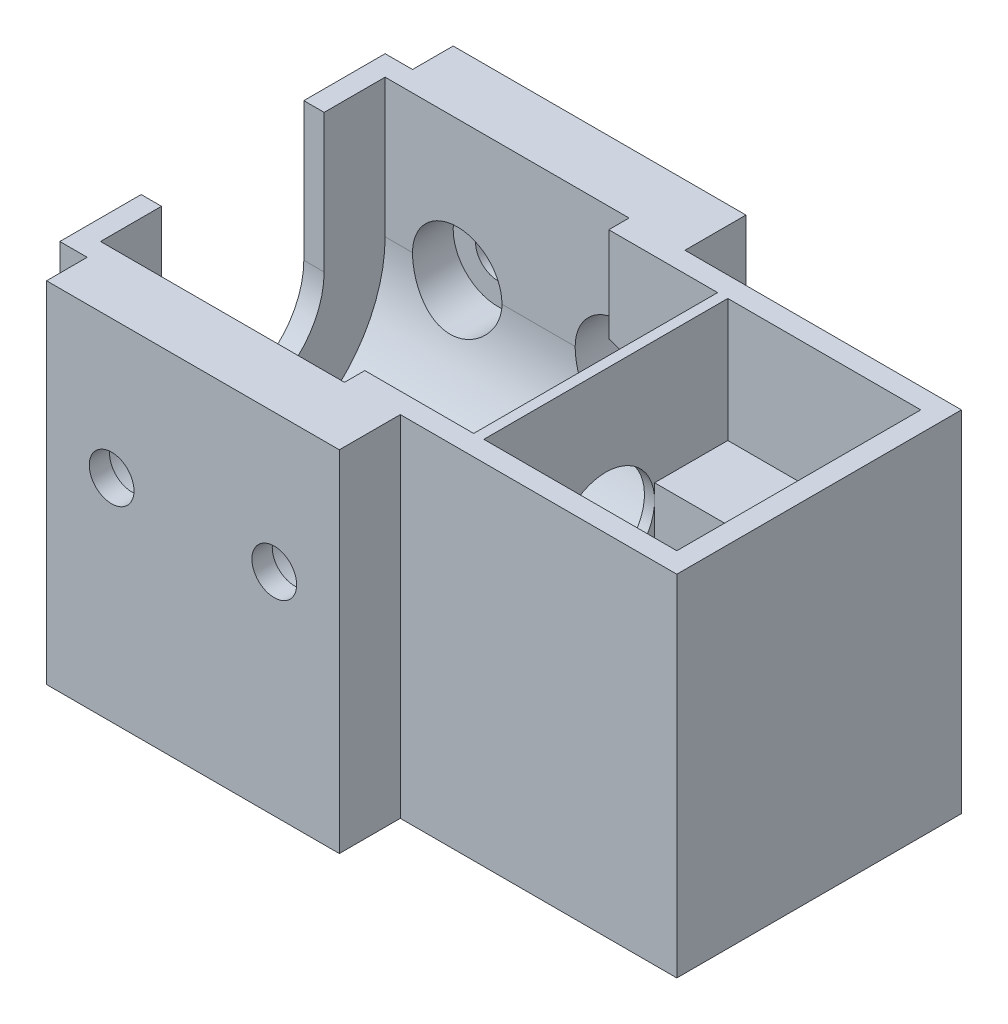
from build123d import *
from build123d.topology import SkipClean

# Parameters (mm, degrees)
SKETCH1_W                       = 116.84
SKETCH1_H                       = 50.8
BOSS_EXTRUDE1_DEPTH             = 31.75
SKETCH38_W                      = 20
SKETCH38_H                      = 20
CUT_EXTRUDE33_DEPTH             = 33.3134
SKETCH37_W                      = 63.5
SKETCH37_H                      = 25.4
CUT_EXTRUDE32_DEPTH             = 132.302277589
BOSS_EXTRUDE5_DEPTH             = 25.4
BOSS_EXTRUDE6_REACH             = 98.929
SKETCH40_W                      = 16.9009
SKETCH40_H                      = 20
SKETCH41_R                      = 3.113413941
CUT_EXTRUDE34_DEPTH             = 97.928543268
CUT_EXTRUDE35_DEPTH             = 97.928543399
CUT_EXTRUDE35_DEPTH_BACK        = 97.928543399
SKETCH42_R                      = 3.4925
SKETCH43_R                      = 6.985
CUT_EXTRUDE36_DEPTH             = 28.575
CUT_EXTRUDE37_START             = 28.575
SKETCH43_2_R                    = 6.985
CUT_EXTRUDE37_DEPTH             = 28.575
SKETCH44_W                      = 15.9125
SKETCH44_H                      = 38.1
CUT_EXTRUDE38_DEPTH             = 35.4
CUT_EXTRUDE39_REACH             = 98.929
SKETCH45_W                      = 14.2259
SKETCH45_H                      = 15.4
CUT_EXTRUDE39_DIRECTION_2_REACH = 98.929
SKETCH46_W                      = 43.18
SKETCH46_H                      = 9.525
SKETCH46_W_2                    = 27.94
SKETCH46_H_2                    = 6.35
CUT_EXTRUDE40_DEPTH             = 97.928543399
SKETCH49_W                      = 23.6641
SKETCH49_H                      = 50.8
CUT_EXTRUDE42_DEPTH             = 97.928543399
SKETCH50_W                      = 0.254
SKETCH50_H                      = 1.524
CUT_EXTRUDE43_DEPTH             = 2.54
SKETCH52_R                      = 0.3175
CUT_EXTRUDE45_DEPTH             = 0.0508
SKETCH53_R                      = 2
CUT_EXTRUDE46_DEPTH             = 0.0254
BOSS_EXTRUDE7_DEPTH             = 2.54
SKETCH55_W                      = 15.9125
SKETCH55_H                      = 9.05
BOSS_EXTRUDE8_DEPTH             = 17.46
BOSS_EXTRUDE9_REACH             = 81.679
BOSS_EXTRUDE9_DIRECTION_2_REACH = 81.679
CUT_EXTRUDE47_DEPTH             = 7.62
SKETCH58_R                      = 3.113413941
BOSS_EXTRUDE10_DEPTH            = 7.62
SKETCH59_W                      = 0.5
SKETCH59_H                      = 20
CUT_EXTRUDE48_DEPTH             = 7.62
CUT_EXTRUDE44_DEPTH             = 0.635
SKETCH60_W                      = 121.35651469
SKETCH60_H                      = 81.059088534
CUT_EXTRUDE49_DEPTH             = 10.16
SKETCH61_R                      = 8.976217823
SKETCH61_R_2                    = 7.62
BOSS_EXTRUDE11_DEPTH            = 1.5875
BOSS_EXTRUDE12_REACH            = 80.084
SKETCH62_W                      = 1.5875
SKETCH62_H                      = 15.24
SKETCH64_W                      = 30.1384
SKETCH64_H                      = 38.1
BOSS_EXTRUDE14_DEPTH            = 6.35
BOSS_EXTRUDE16_REACH            = 91.468
SKETCH65_W                      = 2.38
SKETCH65_H                      = 9.84
SKETCH66_W                      = 0.5
SKETCH66_H                      = 20
CUT_EXTRUDE50_DEPTH             = 20


with BuildPart() as part:
    # Sketch1 → Boss-Extrude1 (new, symmetric)
    with BuildSketch(Plane.XY):
        with Locations((-17.78, -25.4)):
            Rectangle(SKETCH1_W, SKETCH1_H)
    extrude(amount=BOSS_EXTRUDE1_DEPTH, both=True)

    # Sketch2 → Cut-Revolve1 (revolve, cut)
    with BuildSketch(Plane.XY, mode=Mode.PRIVATE) as cut_revolve1_sk:
        Polygon((-49.3609, -3.175), (-49.3609, -12.7), (-220.202391615, -12.7), (-220.202391615, -25.4), (-157.809194346, -25.4), (-128.417210056, -25.4), (6.8382, -25.4), (40.64, -25.4), (40.64, -17.78), (23.7391, -17.78), (5.7391, -17.78), (5.7391, -6.35), (-11.2609, -6.35), (-11.2609, -3.175), align=None)
    revolve(cut_revolve1_sk.sketch.rotate(Axis((-152.482877195, -25.4, 0), (1, 0, 0)), 180), axis=Axis((-152.482877195, -25.4, 0), (1, 0, 0)), mode=Mode.SUBTRACT)

    # Sketch38 → Cut-Extrude33 (cut)
    with BuildSketch(Plane(origin=(40.64, 0, 0), x_dir=(0, 0, -1), z_dir=(1, 0, 0))):
        with Locations((0, -25.4)):
            Rectangle(SKETCH38_W, SKETCH38_H)
    extrude(amount=-CUT_EXTRUDE33_DEPTH, mode=Mode.SUBTRACT)

    # Sketch37 → Cut-Extrude32 (cut, through all)
    with BuildSketch(Plane(origin=(40.64, 0, 0), x_dir=(0, 0, -1), z_dir=(1, 0, 0))):
        with Locations((0, -12.7)):
            Rectangle(SKETCH37_W, SKETCH37_H)
    extrude(amount=-CUT_EXTRUDE32_DEPTH, mode=Mode.SUBTRACT)

    # Sketch39 → Boss-Extrude5 (add)
    with BuildSketch(Plane(origin=(0, -25.4, 0), x_dir=(1, 0, 0), z_dir=(0, 1, 0))):
        Polygon((5.7391, 19.05), (5.7391, 7.62), (7.3266, 7.62), (7.3266, 10), (40.64, 10), (40.64, 31.75), (-76.2, 31.75), (-76.2, 12.7), (-49.3609, 12.7), (-49.3609, 22.225), (-11.2609, 22.225), (-11.2609, 19.05), align=None)
        Polygon((40.64, -10), (7.3266, -10), (7.3266, -7.62), (5.7391, -7.62), (5.7391, -19.05), (-11.2609, -19.05), (-11.2609, -22.225), (-49.3609, -22.225), (-49.3609, -12.7), (-76.2, -12.7), (-76.2, -31.75), (40.64, -31.75), align=None)
    extrude(amount=BOSS_EXTRUDE5_DEPTH)

    # Sketch40 → Boss-Extrude6 (add, up to next)
    with BuildSketch(Plane(origin=(0, 0, 0), x_dir=(1, 0, 0), z_dir=(0, 1, 0)), mode=Mode.PRIVATE) as boss_extrude6_sk1:
        with Locations((32.18955, 0)):
            Rectangle(SKETCH40_W, SKETCH40_H)
    boss_extrude6_tool1 = extrude(boss_extrude6_sk1.sketch, amount=-BOSS_EXTRUDE6_REACH, mode=Mode.PRIVATE) - part.part
    add(boss_extrude6_tool1.solids().sort_by_distance((32.18955, 0, 0))[0])

    # Sketch41 → Cut-Extrude34 (cut, through all)
    with BuildSketch(Plane(origin=(0, 0, 0), x_dir=(1, 0, 0), z_dir=(0, 1, 0))):
        with Locations(Location((-57.15, 0, 0), (0, 0, 270))):
            Circle(SKETCH41_R)
        with Locations(Location((-31.75, 0, 0), (0, 0, 270))):
            Circle(SKETCH41_R)
        with Locations(Location((-6.35, 0, 0), (0, 0, 270))):
            Circle(SKETCH41_R)
    extrude(amount=-CUT_EXTRUDE34_DEPTH, mode=Mode.SUBTRACT)

    # Sketch42 → Cut-Extrude35 (cut, two sides: drawn at the far end of the back side and taken through both)
    with BuildSketch(Plane.XY.offset(-CUT_EXTRUDE35_DEPTH_BACK)):
        with Locations((-38.1, -25.4)):
            Circle(SKETCH42_R)
        with Locations((-12.7, -25.4)):
            Circle(SKETCH42_R)
    extrude(amount=CUT_EXTRUDE35_DEPTH + CUT_EXTRUDE35_DEPTH_BACK, mode=Mode.SUBTRACT)

    # Sketch43 → Cut-Extrude36 (cut)
    with BuildSketch(Plane.XY):
        with Locations(Location((-38.1, -25.4, 0), (0, 0, 180))):
            Circle(SKETCH43_R)
        with Locations(Location((-12.7, -25.4, 0), (0, 0, 180))):
            Circle(SKETCH43_R)
    extrude(amount=-CUT_EXTRUDE36_DEPTH, mode=Mode.SUBTRACT)

    # Sketch43<2> → Cut-Extrude37 (cut)
    with BuildSketch(Plane.XY.offset(CUT_EXTRUDE37_START)):
        with Locations(Location((-38.1, -25.4, 0), (0, 0, 180))):
            Circle(SKETCH43_2_R)
        with Locations(Location((-12.7, -25.4, 0), (0, 0, 180))):
            Circle(SKETCH43_2_R)
    extrude(amount=-CUT_EXTRUDE37_DEPTH, mode=Mode.SUBTRACT)

    # Sketch44 → Cut-Extrude38 (cut)
    with BuildSketch(Plane(origin=(0, 0, 0), x_dir=(1, 0, 0), z_dir=(0, 1, 0))):
        with Locations((15.28285, 0)):
            Rectangle(SKETCH44_W, SKETCH44_H)
    extrude(amount=-CUT_EXTRUDE38_DEPTH, mode=Mode.SUBTRACT)

    # Cut-Extrude39: up to this face of the body (flat: up to its plane)
    cut_extrude39_end = Plane(part.part.faces().sort_by_distance((15.28285, -17.7, -19.05))[0])
    # Sketch45 → Cut-Extrude39 (cut, up to the picked face)
    with BuildSketch(Plane.XY, mode=Mode.PRIVATE) as cut_extrude39_sk1:
        with Locations((30.35205, -7.7)):
            Rectangle(SKETCH45_W, SKETCH45_H)
    cut_extrude39_tool1 = split(extrude(cut_extrude39_sk1.sketch, amount=-CUT_EXTRUDE39_REACH, mode=Mode.PRIVATE), bisect_by=cut_extrude39_end, keep=Keep.BOTH, mode=Mode.PRIVATE)
    add(cut_extrude39_tool1.solids().sort_by(Axis((30.35205, -7.7, 0), (0, 0, -1)))[0], mode=Mode.SUBTRACT)

    # Cut-Extrude39 direction 2: up to this face of the body (flat: up to its plane)
    cut_extrude39_direction_2_end = Plane(part.part.faces().sort_by_distance((15.28285, -17.7, 19.05))[0])
    # Sketch45 → Cut-Extrude39 direction 2 (cut, up to the picked face)
    with BuildSketch(Plane.XY, mode=Mode.PRIVATE) as cut_extrude39_direction_2_sk1:
        with Locations((30.35205, -7.7)):
            Rectangle(SKETCH45_W, SKETCH45_H)
    cut_extrude39_direction_2_tool1 = split(extrude(cut_extrude39_direction_2_sk1.sketch, amount=CUT_EXTRUDE39_DIRECTION_2_REACH, mode=Mode.PRIVATE), bisect_by=cut_extrude39_direction_2_end, keep=Keep.BOTH, mode=Mode.PRIVATE)
    add(cut_extrude39_direction_2_tool1.solids().sort_by(Axis((30.35205, -7.7, 0), (0, 0, 1)))[0], mode=Mode.SUBTRACT)

    # Sketch46 → Cut-Extrude40 (cut, through all)
    with BuildSketch(Plane(origin=(0, 0, 0), x_dir=(1, 0, 0), z_dir=(0, 1, 0))):
        with Locations((19.05, 26.9875)):
            Rectangle(SKETCH46_W, SKETCH46_H)
        with Locations((19.05, -26.9875)):
            Rectangle(SKETCH46_W, SKETCH46_H)
        with Locations((-62.23, 28.575)):
            Rectangle(SKETCH46_W_2, SKETCH46_H_2)
        with Locations((-62.23, -28.575)):
            Rectangle(SKETCH46_W_2, SKETCH46_H_2)
    extrude(amount=-CUT_EXTRUDE40_DEPTH, mode=Mode.SUBTRACT)

    # Sketch49 → Cut-Extrude42 (cut, through all)
    with BuildSketch(Plane(origin=(0, 0, 0), x_dir=(1, 0, 0), z_dir=(0, 1, 0))):
        with Locations((-64.36795, 0)):
            Rectangle(SKETCH49_W, SKETCH49_H)
    extrude(amount=-CUT_EXTRUDE42_DEPTH, mode=Mode.SUBTRACT)

    # Sketch50 → Cut-Extrude43 (cut)
    with BuildSketch(Plane(origin=(0, 0, 0), x_dir=(1, 0, 0), z_dir=(0, 1, 0))):
        with Locations((23.1121, 21.463)):
            Rectangle(SKETCH50_W, SKETCH50_H)
        with Locations((21.5881, 21.463)):
            Rectangle(SKETCH50_W, SKETCH50_H)
        with Locations((20.0641, 21.463)):
            Rectangle(SKETCH50_W, SKETCH50_H)
        with Locations((18.5401, 21.463)):
            Rectangle(SKETCH50_W, SKETCH50_H)
        with Locations((17.0161, 21.463)):
            Rectangle(SKETCH50_W, SKETCH50_H)
        with Locations((15.4921, 21.463)):
            Rectangle(SKETCH50_W, SKETCH50_H)
        with Locations((13.9681, 21.463)):
            Rectangle(SKETCH50_W, SKETCH50_H)
        with Locations((12.4441, 21.463)):
            Rectangle(SKETCH50_W, SKETCH50_H)
        with Locations((10.9201, 21.463)):
            Rectangle(SKETCH50_W, SKETCH50_H)
        with Locations((9.3961, 21.463)):
            Rectangle(SKETCH50_W, SKETCH50_H)
    extrude(amount=-CUT_EXTRUDE43_DEPTH, mode=Mode.SUBTRACT)

    # Sketch52 → Cut-Extrude45 (cut)
    with BuildSketch(Plane.ZY.offset(-23.7391)):
        with Locations(Location((0, -25.4, 0), (0, 0, 270))):
            Circle(SKETCH52_R)
    extrude(amount=-CUT_EXTRUDE45_DEPTH, mode=Mode.SUBTRACT)

    # Sketch53 → Cut-Extrude46 (cut)
    with BuildSketch(Plane.ZY.offset(-23.7391)):
        with Locations(Location((0, -25.4, 0), (0, 0, 270))):
            Circle(SKETCH53_R)
    extrude(amount=-CUT_EXTRUDE46_DEPTH, mode=Mode.SUBTRACT)

    # Sketch54 → Boss-Extrude7 (add)
    with BuildSketch(Plane(origin=(0, -35.4, 0), x_dir=(1, 0, 0), z_dir=(0, 1, 0))):
        Polygon((23.2391, 10), (23.2391, -10), (23.2391, -19.05), (7.3266, -19.05), (7.3266, 19.05), (23.2391, 19.05), align=None)
    extrude(amount=BOSS_EXTRUDE7_DEPTH)

    # Sketch55 → Boss-Extrude8 (add)
    with BuildSketch(Plane(origin=(0, -32.86, 0), x_dir=(1, 0, 0), z_dir=(0, 1, 0))):
        with Locations((15.28285, 14.525)):
            Rectangle(SKETCH55_W, SKETCH55_H)
        with Locations((15.28285, -14.525)):
            Rectangle(SKETCH55_W, SKETCH55_H)
    extrude(amount=BOSS_EXTRUDE8_DEPTH)

    # Sketch56 → Boss-Extrude9 (add, up to next)
    with BuildSketch(Plane.XY, mode=Mode.PRIVATE) as boss_extrude9_sk1:
        with BuildLine():
            Line((16.8891, -27.4), (23.2391, -27.4))
            Line((23.2391, -27.4), (23.2391, -32.86))
            Line((23.2391, -32.86), (7.3266, -32.86))
            add(Edge.make_bspline(
                [(7.3266, -32.86), (8.258769565, -32.86), (15.224480894, -27.985980084), (15.571325546, -27.4), (16.8891, -27.4)],
                knots=[0, 0, 0, 0, 0.327130602, 1, 1, 1, 1], degree=3))
        make_face()
    boss_extrude9_tool1 = extrude(boss_extrude9_sk1.sketch, amount=BOSS_EXTRUDE9_REACH, mode=Mode.PRIVATE) - part.part
    add(boss_extrude9_tool1.solids().sort_by_distance((17.400191, -30.455241, 0))[0])

    # Sketch56 → Boss-Extrude9 direction 2 (add, up to next)
    with BuildSketch(Plane.XY, mode=Mode.PRIVATE) as boss_extrude9_direction_2_sk1:
        with BuildLine():
            Line((16.8891, -27.4), (23.2391, -27.4))
            Line((23.2391, -27.4), (23.2391, -32.86))
            Line((23.2391, -32.86), (7.3266, -32.86))
            add(Edge.make_bspline(
                [(7.3266, -32.86), (8.258769565, -32.86), (15.224480894, -27.985980084), (15.571325546, -27.4), (16.8891, -27.4)],
                knots=[0, 0, 0, 0, 0.327130602, 1, 1, 1, 1], degree=3))
        make_face()
    boss_extrude9_direction_2_tool1 = extrude(boss_extrude9_direction_2_sk1.sketch, amount=-BOSS_EXTRUDE9_DIRECTION_2_REACH, mode=Mode.PRIVATE) - part.part
    add(boss_extrude9_direction_2_tool1.solids().sort_by_distance((17.400191, -30.455241, 0))[0])

    # Sketch57 → Cut-Extrude47 (cut)
    with BuildSketch(Plane(origin=(0, -15.4, 0), x_dir=(1, 0, 0), z_dir=(0, 1, 0))):
        Polygon((23.7391, -10), (7.3266, -10), (7.3266, -19.05), (37.465, -19.05), (37.465, 19.05), (7.3266, 19.05), (7.3266, 10), (23.7391, 10), align=None)
    extrude(amount=-CUT_EXTRUDE47_DEPTH, mode=Mode.SUBTRACT)

    # Sketch58 → Boss-Extrude10 (add)
    with SkipClean():  # the faces are left unmerged after this step: merging them gives an invalid solid
        with BuildSketch(Plane.XZ.offset(50.8)):
            Polygon((-48.26, 25.4), (-52.5359, 25.4), (-52.5359, -25.4), (-48.26, -25.4), (-48.26, -31.75), (-2.54, -31.75), (-2.54, -22.225), (40.64, -22.225), (40.64, 22.225), (-2.54, 22.225), (-2.54, 31.75), (-48.26, 31.75), align=None)
            with Locations((-31.75, 0)):
                Circle(SKETCH58_R, mode=Mode.SUBTRACT)
            with Locations(Location((-6.35, 0, 0), (0, 0, 90))):
                Circle(SKETCH58_R, mode=Mode.SUBTRACT)
        extrude(amount=BOSS_EXTRUDE10_DEPTH)

    # Sketch59 → Cut-Extrude48 (cut)
    with SkipClean():  # the faces are left unmerged after this step: merging them gives an invalid solid
        with BuildSketch(Plane(origin=(0, -35.4, 0), x_dir=(1, 0, 0), z_dir=(0, 1, 0))):
            with Locations((23.4891, 0)):
                Rectangle(SKETCH59_W, SKETCH59_H)
        extrude(amount=-CUT_EXTRUDE48_DEPTH, mode=Mode.SUBTRACT)

    # Sketch51 → Cut-Extrude44 (cut)
    with SkipClean():  # the faces are left unmerged after this step: merging them gives an invalid solid
        with BuildSketch(Plane(origin=(0, -23.02, 0), x_dir=(1, 0, 0), z_dir=(0, 1, 0))):
            Polygon((25.098, 0.254), (26.10821862, 0.254), (26.10821862, 2.54), (26.61621862, 2.54), (26.61621862, 0.254), (27.62643724, 0.254), (27.62643724, 2.54), (28.13443724, 2.54), (28.13443724, 0.254), (29.14465586, 0.254), (29.14465586, 2.54), (29.65265586, 2.54), (29.65265586, 0.254), (30.66287448, 0.254), (30.66287448, 2.54), (31.17087448, 2.54), (31.17087448, 0.254), (32.1810931, 0.254), (32.1810931, 2.54), (32.6890931, 2.54), (32.6890931, 0.254), (33.69931172, 0.254), (33.69931172, 2.54), (34.20731172, 2.54), (34.20731172, 0.254), (35.21753034, 0.254), (35.21753034, 2.54), (35.72553034, 2.54), (35.72553034, 0.254), (37.465, 0.254), (37.465, -0.254), (35.72553034, -0.254), (35.72553034, -2.54), (35.21753034, -2.54), (35.21753034, -0.254), (34.20731172, -0.254), (34.20731172, -2.54), (33.69931172, -2.54), (33.69931172, -0.254), (32.6890931, -0.254), (32.6890931, -2.54), (32.1810931, -2.54), (32.1810931, -0.254), (31.17087448, -0.254), (31.17087448, -2.54), (30.66287448, -2.54), (30.66287448, -0.254), (29.65265586, -0.254), (29.65265586, -2.54), (29.14465586, -2.54), (29.14465586, -0.254), (28.13443724, -0.254), (28.13443724, -2.54), (27.62643724, -2.54), (27.62643724, -0.254), (26.61621862, -0.254), (26.61621862, -2.54), (26.10821862, -2.54), (26.10821862, -0.254), (25.098, -0.254), (25.098, -2.54), (24.59, -2.54), (24.59, -0.254), (23.7391, -0.254), (23.7391, 0.254), (24.59, 0.254), (24.59, 2.54), (25.098, 2.54), align=None)
            Polygon((27.745064103, 14.333054385), (28.384487179, 14.333054385), (29.046346154, 12.82353916), (29.708205128, 14.333054385), (30.347628205, 14.333054385), (29.227235577, 11.775362077), (28.865456731, 11.775362077), align=None)
            Polygon((30.684166667, 15.275362077), (32.92775641, 15.275362077), (32.92775641, 14.949340442), (31.383886218, 11.685618487), (30.827195513, 11.966067205), (32.117259615, 14.692028743), (30.684166667, 14.692028743), align=None)
        extrude(amount=-CUT_EXTRUDE44_DEPTH, mode=Mode.SUBTRACT)

    # Sketch60 → Cut-Extrude49 (cut)
    with SkipClean():  # the faces are left unmerged after this step: merging them gives an invalid solid
        with BuildSketch(Plane(origin=(0, 0, 0), x_dir=(1, 0, 0), z_dir=(0, 1, 0))):
            Rectangle(SKETCH60_W, SKETCH60_H)
        extrude(amount=-CUT_EXTRUDE49_DEPTH, mode=Mode.SUBTRACT)

    # Sketch61 → Boss-Extrude11 (add)
    with SkipClean():  # the faces are left unmerged after this step: merging them gives an invalid solid
        with BuildSketch(Plane.ZY.offset(-5.7391)):
            with Locations((0, -25.4)):
                Circle(SKETCH61_R)
            with Locations(Location((0, -25.4, 0), (0, 0, 270))):
                Circle(SKETCH61_R_2, mode=Mode.SUBTRACT)
        extrude(amount=-BOSS_EXTRUDE11_DEPTH)

    # Sketch62 → Boss-Extrude12 (add, up to next)
    with BuildSketch(Plane(origin=(0, -10.16, 0), x_dir=(1, 0, 0), z_dir=(0, 1, 0)), mode=Mode.PRIVATE) as boss_extrude12_sk1:
        with Locations((6.53285, 0)):
            Rectangle(SKETCH62_W, SKETCH62_H)
    boss_extrude12_tool1 = extrude(boss_extrude12_sk1.sketch, amount=-BOSS_EXTRUDE12_REACH, mode=Mode.PRIVATE) - part.part
    add(boss_extrude12_tool1.solids().sort_by_distance((6.53285, -10.16, 0))[0])

    # Sketch64 → Boss-Extrude14 (add)
    with BuildSketch(Plane(origin=(0, -10.16, 0), x_dir=(1, 0, 0), z_dir=(0, 1, 0))):
        Polygon((-11.2609, 19.05), (5.7391, 19.05), (5.7391, -19.05), (-11.2609, -19.05), (-11.2609, -22.225), (-49.3609, -22.225), (-49.3609, -12.7), (-52.5359, -12.7), (-52.5359, -25.4), (-48.26, -25.4), (-48.26, -31.75), (-2.54, -31.75), (-2.54, -22.225), (40.64, -22.225), (40.64, 22.225), (-2.54, 22.225), (-2.54, 31.75), (-48.26, 31.75), (-48.26, 25.4), (-52.5359, 25.4), (-52.5359, 12.7), (-49.3609, 12.7), (-49.3609, 22.225), (-11.2609, 22.225), align=None)
        with Locations((22.3958, 0)):
            Rectangle(SKETCH64_W, SKETCH64_H, mode=Mode.SUBTRACT)
    extrude(amount=BOSS_EXTRUDE14_DEPTH)

    # Sketch65 → Boss-Extrude16 (add, up to next)
    with BuildSketch(Plane(origin=(7.3266, 0, 0), x_dir=(0, 0, -1), z_dir=(1, 0, 0)), mode=Mode.PRIVATE) as boss_extrude16_sk1:
        with Locations((-8.81, -27.94)):
            Rectangle(SKETCH65_W, SKETCH65_H)
    boss_extrude16_tool1 = extrude(boss_extrude16_sk1.sketch, amount=BOSS_EXTRUDE16_REACH, mode=Mode.PRIVATE) - part.part
    # Sketch65 → Boss-Extrude16 (add, up to next)
    with BuildSketch(Plane(origin=(7.3266, 0, 0), x_dir=(0, 0, -1), z_dir=(1, 0, 0)), mode=Mode.PRIVATE) as boss_extrude16_sk2:
        with Locations((8.81, -27.94)):
            Rectangle(SKETCH65_W, SKETCH65_H)
    boss_extrude16_tool2 = extrude(boss_extrude16_sk2.sketch, amount=BOSS_EXTRUDE16_REACH, mode=Mode.PRIVATE) - part.part
    add(boss_extrude16_tool1.solids().sort_by_distance((7.3266, -27.94, 8.81))[0])
    add(boss_extrude16_tool2.solids().sort_by_distance((7.3266, -27.94, -8.81))[0])

    # Sketch66 → Cut-Extrude50 (cut)
    with BuildSketch(Plane(origin=(0, -23.02, 0), x_dir=(1, 0, 0), z_dir=(0, 1, 0))):
        with Locations((23.4891, 0)):
            Rectangle(SKETCH66_W, SKETCH66_H)
    extrude(amount=-CUT_EXTRUDE50_DEPTH, mode=Mode.SUBTRACT)


solid = part.part
